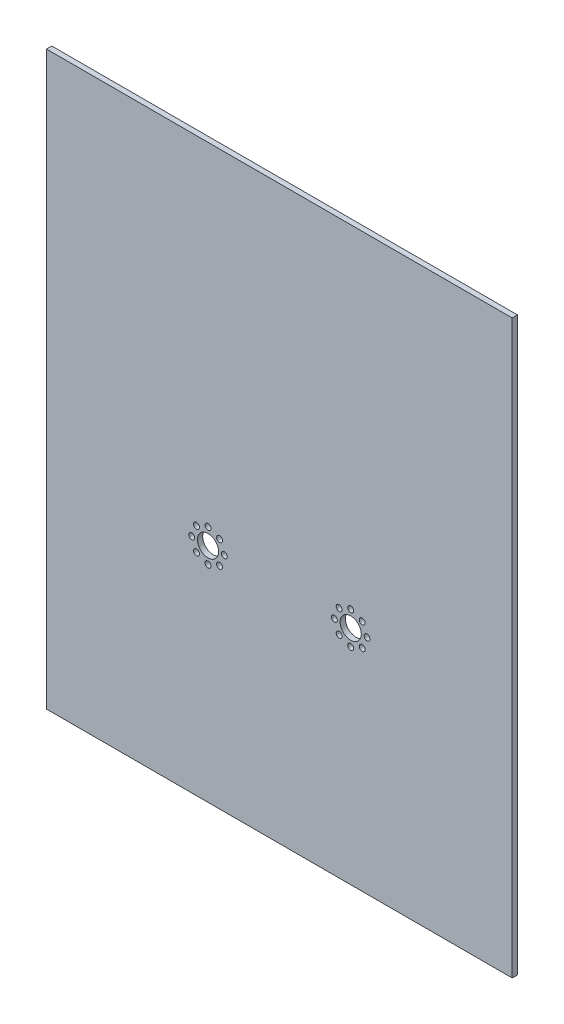
from build123d import *

# Parameters (mm, degrees)
SKETCH1_W               = 279.4
SKETCH1_H               = 342.9
BOSS_EXTRUDE1_DEPTH     = 3.175
SKETCH2_R               = 1.778
CUT_EXTRUDE1_DEPTH      = 3.175
SKETCH3_R               = 6.35
CUT_EXTRUDE2_DEPTH      = 3.175
CIRPATTERN1_COUNT       = 8
MIRROR2_COPY_1_SKETCH_R = 1.778
MIRROR2_COPY_1_DEPTH    = 3.175
MIRROR2_COPY_2_SKETCH_R = 1.778
MIRROR2_COPY_2_DEPTH    = 3.175
MIRROR2_COPY_3_SKETCH_R = 1.778
MIRROR2_COPY_3_DEPTH    = 3.175
MIRROR2_COPY_4_SKETCH_R = 1.778
MIRROR2_COPY_4_DEPTH    = 3.175
MIRROR2_COPY_5_SKETCH_R = 1.778
MIRROR2_COPY_5_DEPTH    = 3.175
MIRROR2_COPY_6_SKETCH_R = 1.778
MIRROR2_COPY_6_DEPTH    = 3.175
MIRROR2_COPY_7_SKETCH_R = 1.778
MIRROR2_COPY_7_DEPTH    = 3.175
MIRROR2_COPY_8_SKETCH_R = 1.778
MIRROR2_COPY_8_DEPTH    = 3.175


with BuildPart() as part:
    # Sketch1 → Boss-Extrude1 (new body)
    with BuildSketch(Plane.XY):
        with Locations((-139.7, -171.45)):
            Rectangle(SKETCH1_W, SKETCH1_H)
    extrude(amount=BOSS_EXTRUDE1_DEPTH)

    # Sketch2 → Cut-Extrude1 (cut)
    with BuildSketch(Plane(origin=(0, 0, 0), x_dir=(-1, 0, 0), z_dir=(0, 0, -1))):
        with Locations((87.122, -209.55)):
            Circle(SKETCH2_R)
    cut_extrude1 = extrude(amount=-CUT_EXTRUDE1_DEPTH, mode=Mode.SUBTRACT)

    # Mirror1: Cut-Extrude1 across plane
    add(cut_extrude1.mirror(Plane(origin=(-139.7, 0, 0), x_dir=(0, 0, 1), z_dir=(1, 0, 0))), mode=Mode.SUBTRACT)

    # Sketch3 → Cut-Extrude2 (cut)
    with BuildSketch(Plane(origin=(0, 0, 0), x_dir=(-1, 0, 0), z_dir=(0, 0, -1))):
        with Locations((96.901, -209.55)):
            Circle(SKETCH3_R)
    cut_extrude2 = extrude(amount=-CUT_EXTRUDE2_DEPTH, mode=Mode.SUBTRACT)

    # CirPattern1: Cut-Extrude1 ×8 about axis
    cirpattern1_axis = Axis((-96.901, -209.55, 0), (0, 0, -1))
    for i in range(1, CIRPATTERN1_COUNT):
        add(cut_extrude1.rotate(cirpattern1_axis, i * 360 / CIRPATTERN1_COUNT), mode=Mode.SUBTRACT)

    # Mirror2: Cut-Extrude2 across plane
    add(cut_extrude2.mirror(Plane(origin=(-139.7, 0, 0), x_dir=(0, 0, 1), z_dir=(1, 0, 0))), mode=Mode.SUBTRACT)

    # Mirror2 copy 1 sketch → Mirror2 copy 1 (cut)
    with BuildSketch(Plane(origin=(-399.192580201, -129.895128206, 0), x_dir=(0.7071067811865478, 0.7071067811865472, 0), z_dir=(0, 0, -1))):
        with Locations((87.122, 209.55)):
            Circle(MIRROR2_COPY_1_SKETCH_R)
    extrude(amount=-MIRROR2_COPY_1_DEPTH, mode=Mode.SUBTRACT)

    # Mirror2 copy 2 sketch → Mirror2 copy 2 (cut)
    with BuildSketch(Plane(origin=(-392.049, -306.451, 0), x_dir=(0, 1, 0), z_dir=(0, 0, -1))):
        with Locations((87.122, 209.55)):
            Circle(MIRROR2_COPY_2_SKETCH_R)
    extrude(amount=-MIRROR2_COPY_2_DEPTH, mode=Mode.SUBTRACT)

    # Mirror2 copy 3 sketch → Mirror2 copy 3 (cut)
    with BuildSketch(Plane(origin=(-262.153871794, -426.243580201, 0), x_dir=(-0.7071067811865472, 0.7071067811865478, 0), z_dir=(0, 0, -1))):
        with Locations((87.122, 209.55)):
            Circle(MIRROR2_COPY_3_SKETCH_R)
    extrude(amount=-MIRROR2_COPY_3_DEPTH, mode=Mode.SUBTRACT)

    # Mirror2 copy 4 sketch → Mirror2 copy 4 (cut)
    with BuildSketch(Plane(origin=(-85.598, -419.1, 0), x_dir=(-1, 0, 0), z_dir=(0, 0, -1))):
        with Locations((87.122, 209.55)):
            Circle(MIRROR2_COPY_4_SKETCH_R)
    extrude(amount=-MIRROR2_COPY_4_DEPTH, mode=Mode.SUBTRACT)

    # Mirror2 copy 5 sketch → Mirror2 copy 5 (cut)
    with BuildSketch(Plane(origin=(34.194580201, -289.204871794, 0), x_dir=(-0.7071067811865479, -0.7071067811865472, 0), z_dir=(0, 0, -1))):
        with Locations((87.122, 209.55)):
            Circle(MIRROR2_COPY_5_SKETCH_R)
    extrude(amount=-MIRROR2_COPY_5_DEPTH, mode=Mode.SUBTRACT)

    # Mirror2 copy 6 sketch → Mirror2 copy 6 (cut)
    with BuildSketch(Plane(origin=(27.051, -112.649, 0), x_dir=(0, -1, 0), z_dir=(0, 0, -1))):
        with Locations((87.122, 209.55)):
            Circle(MIRROR2_COPY_6_SKETCH_R)
    extrude(amount=-MIRROR2_COPY_6_DEPTH, mode=Mode.SUBTRACT)

    # Mirror2 copy 7 sketch → Mirror2 copy 7 (cut)
    with BuildSketch(Plane(origin=(-102.844128206, 7.143580201, 0), x_dir=(0.7071067811865471, -0.7071067811865479, 0), z_dir=(0, 0, -1))):
        with Locations((87.122, 209.55)):
            Circle(MIRROR2_COPY_7_SKETCH_R)
    extrude(amount=-MIRROR2_COPY_7_DEPTH, mode=Mode.SUBTRACT)

    # Mirror2 copy 8 sketch → Mirror2 copy 8 (cut)
    with BuildSketch(Plane(origin=(-279.4, 0, 0), x_dir=(1, 0, 0), z_dir=(0, 0, -1))):
        with Locations((87.122, 209.55)):
            Circle(MIRROR2_COPY_8_SKETCH_R)
    extrude(amount=-MIRROR2_COPY_8_DEPTH, mode=Mode.SUBTRACT)


solid = part.part
